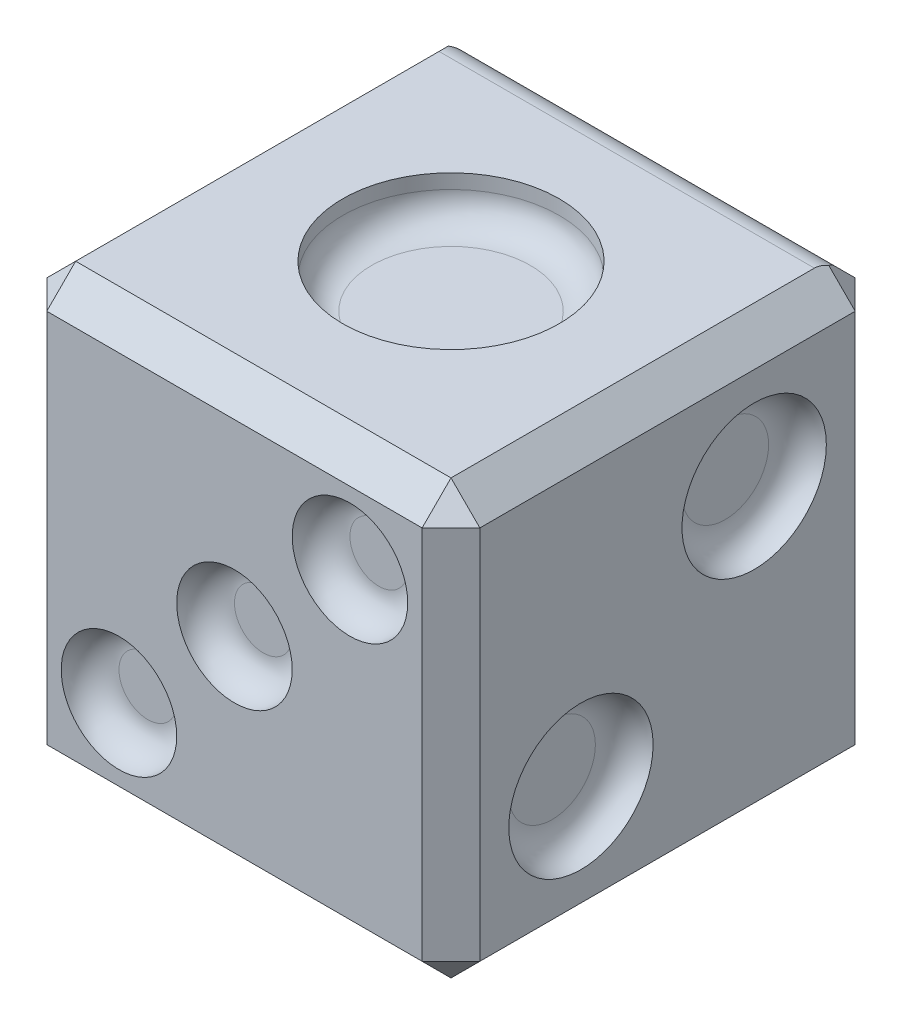
from build123d import *

# Parameters (mm, degrees)
SKETCH_7_W          = 30
SKETCH_7_H          = 30
EXTRUDE_1_DEPTH     = 30
CHAMFER_2_SIZE      = 2
SKETCH_11_R         = 7.5
CUT_EXTRUDE_4_DEPTH = 3
FILLET_1_R          = 2
SKETCH_12_R         = 4
CUT_EXTRUDE_5_DEPTH = 2
FILLET_2_R          = 2
SKETCH_13_R         = 4
CUT_EXTRUDE_6_DEPTH = 2
FILLET_3_R          = 2
SKETCH_14_R         = 4.5
CUT_EXTRUDE_7_DEPTH = 2
FILLET_4_R          = 2
SKETCH_15_R         = 5
CUT_EXTRUDE_8_DEPTH = 2
FILLET_5_R          = 2
SKETCH_16_R         = 4
CUT_EXTRUDE_9_DEPTH = 2
FILLET_6_R          = 2


with BuildPart() as part:
    # ｽｹｯﾁ7 → ﾎﾞｽ - 押し出し1 (new body)
    with BuildSketch(Plane(origin=(0, 0, 0), x_dir=(1, 0, 0), z_dir=(0, 1, 0))):
        with Locations((15, 15)):
            Rectangle(SKETCH_7_W, SKETCH_7_H)
    extrude(amount=EXTRUDE_1_DEPTH)

    # 面取り2
    chamfer_2_edges = [part.edges().sort_by_distance(p)[0] for p in [
        (15, 30, 0),
        (0, 30, -15),
        (15, 30, -30),
        (0, 0, -15),
        (15, 0, 0),
        (30, 0, -15),
        (15, 0, -30),
        (0, 15, -30),
        (0, 15, 0),
        (30, 15, 0),
        (30, 15, -30),
        (30, 30, -15),
    ]]
    chamfer(chamfer_2_edges, length=CHAMFER_2_SIZE)

    # ｽｹｯﾁ11 → ｶｯﾄ - 押し出し4 (cut)
    with BuildSketch(Plane(origin=(0, 30, 0), x_dir=(1, 0, 0), z_dir=(0, 1, 0))):
        with Locations(Location((15, 15, 0), (0, 0, 270))):
            Circle(SKETCH_11_R)
    extrude(amount=-CUT_EXTRUDE_4_DEPTH, mode=Mode.SUBTRACT)

    # ﾌｨﾚｯﾄ1
    fillet_1_edges = [part.edges().sort_by_distance(p)[0] for p in [
        (15, 27, -22.5),
    ]]
    fillet(fillet_1_edges, radius=FILLET_1_R)

    # ｽｹｯﾁ12 → ｶｯﾄ - 押し出し5 (cut)
    with BuildSketch(Plane.XY):
        with Locations((23, 23)):
            Circle(SKETCH_12_R)
        with Locations((15, 15)):
            Circle(SKETCH_12_R)
        with Locations((7, 7)):
            Circle(SKETCH_12_R)
    extrude(amount=-CUT_EXTRUDE_5_DEPTH, mode=Mode.SUBTRACT)

    # ﾌｨﾚｯﾄ2
    fillet_2_edges = [part.edges().sort_by_distance(p)[0] for p in [
        (11, 15, -2),
        (3, 7, -2),
        (19, 23, -2),
    ]]
    fillet(fillet_2_edges, radius=FILLET_2_R - 0.0001)  # a hair under: the kernel refuses the full size

    # ｽｹｯﾁ13 → ｶｯﾄ - 押し出し6 (cut)
    with BuildSketch(Plane.XZ):
        with Locations(Location((7.5, -6.5, 0), (0, 0, 270))):
            Circle(SKETCH_13_R)
        with Locations(Location((7.5, -15, 0), (0, 0, 270))):
            Circle(SKETCH_13_R)
        with Locations(Location((7.5, -23.5, 0), (0, 0, 270))):
            Circle(SKETCH_13_R)
        with Locations(Location((22.5, -23.5, 0), (0, 0, 270))):
            Circle(SKETCH_13_R)
        with Locations(Location((22.5, -15, 0), (0, 0, 270))):
            Circle(SKETCH_13_R)
        with Locations(Location((22.5, -6.5, 0), (0, 0, 270))):
            Circle(SKETCH_13_R)
    extrude(amount=-CUT_EXTRUDE_6_DEPTH, mode=Mode.SUBTRACT)

    # ﾌｨﾚｯﾄ3
    fillet_3_edges = [part.edges().sort_by_distance(p)[0] for p in [
        (7.5, 2, -19.5),
        (7.5, 2, -11),
        (7.5, 2, -2.5),
        (15, 30, -28),
        (22.5, 2, -2.5),
        (22.5, 2, -11),
        (22.5, 2, -19.5),
    ]]
    fillet(fillet_3_edges, radius=FILLET_3_R - 0.0001)  # a hair under: the kernel refuses the full size

    # ｽｹｯﾁ14 → ｶｯﾄ - 押し出し7 (cut)
    with BuildSketch(Plane(origin=(0, 0, -30), x_dir=(-1, 0, 0), z_dir=(0, 0, -1))):
        with Locations((-21.5, 20.914213562)):
            Circle(SKETCH_14_R)
        with Locations((-8.5, 20.914213562)):
            Circle(SKETCH_14_R)
        with Locations((-21.5, 8.5)):
            Circle(SKETCH_14_R)
        with Locations((-8.5, 8.5)):
            Circle(SKETCH_14_R)
    extrude(amount=-CUT_EXTRUDE_7_DEPTH, mode=Mode.SUBTRACT)

    # ﾌｨﾚｯﾄ4
    fillet_4_edges = [part.edges().sort_by_distance(p)[0] for p in [
        (26, 8.5, -28),
        (13, 20.914213562, -28),
        (13, 8.5, -28),
        (26, 20.914213562, -28),
    ]]
    fillet(fillet_4_edges, radius=FILLET_4_R - 0.0001)  # a hair under: the kernel refuses the full size

    # ｽｹｯﾁ15 → ｶｯﾄ - 押し出し8 (cut)
    with BuildSketch(Plane(origin=(30, 0, 0), x_dir=(0, 0, -1), z_dir=(1, 0, 0))):
        with Locations((21, 21)):
            Circle(SKETCH_15_R)
        with Locations((9, 9)):
            Circle(SKETCH_15_R)
    extrude(amount=-CUT_EXTRUDE_8_DEPTH, mode=Mode.SUBTRACT)

    # ﾌｨﾚｯﾄ5
    fillet_5_edges = [part.edges().sort_by_distance(p)[0] for p in [
        (28, 21, -16),
        (28, 9, -4),
    ]]
    fillet(fillet_5_edges, radius=FILLET_5_R - 0.0001)  # a hair under: the kernel refuses the full size

    # ｽｹｯﾁ16 → ｶｯﾄ - 押し出し9 (cut)
    with BuildSketch(Plane.ZY):
        with Locations((-23, 23)):
            Circle(SKETCH_16_R)
        with Locations((-23, 7)):
            Circle(SKETCH_16_R)
        with Locations((-15, 15)):
            Circle(SKETCH_16_R)
        with Locations((-7, 23)):
            Circle(SKETCH_16_R)
        with Locations((-7, 7)):
            Circle(SKETCH_16_R)
    extrude(amount=-CUT_EXTRUDE_9_DEPTH, mode=Mode.SUBTRACT)

    # ﾌｨﾚｯﾄ6
    fillet_6_edges = [part.edges().sort_by_distance(p)[0] for p in [
        (2, 15, -19),
        (2, 23, -11),
        (2, 7, -27),
        (2, 7, -11),
        (2, 23, -27),
    ]]
    fillet(fillet_6_edges, radius=FILLET_6_R - 0.0001)  # a hair under: the kernel refuses the full size


solid = part.part
